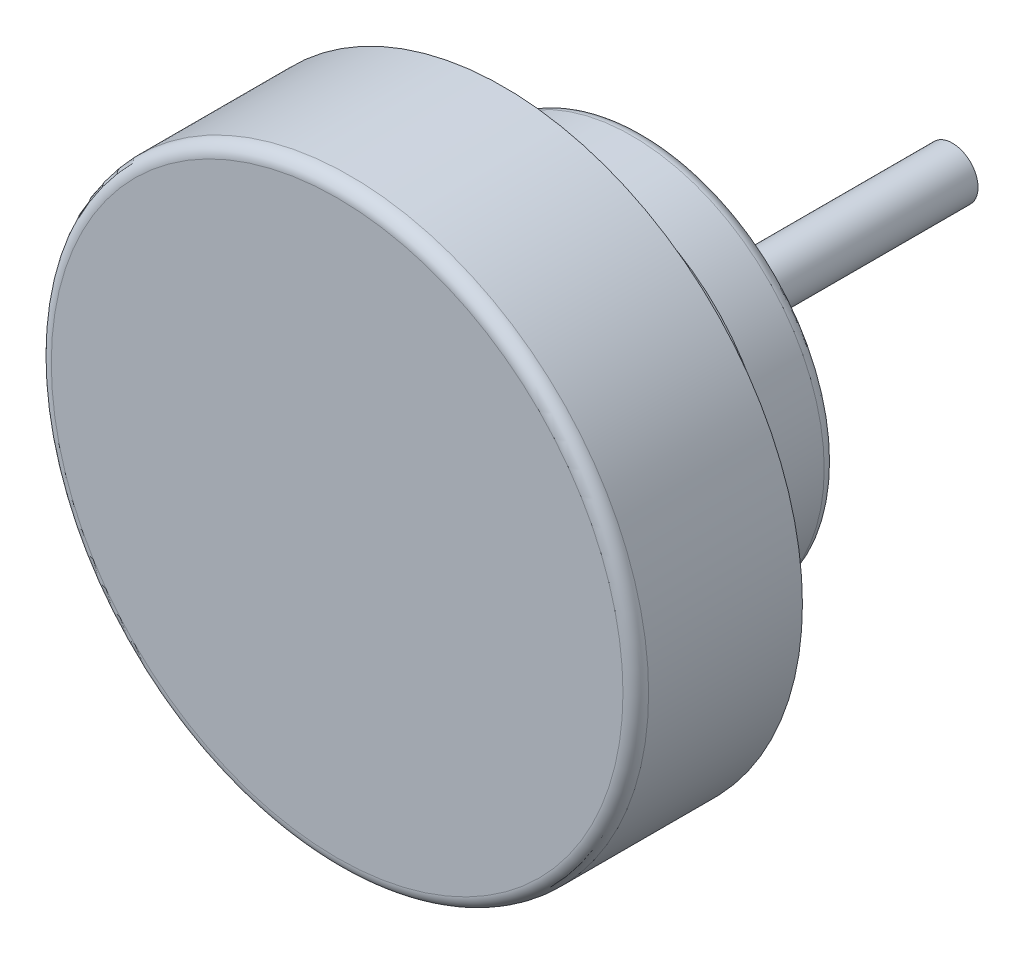
from build123d import *

# Parameters (mm, degrees)
SKETCH1_R           = 11.65
BOSS_EXTRUDE1_DEPTH = 6.5
FILLET1_R           = 0.5
SKETCH2_R           = 3.25
BOSS_EXTRUDE2_DEPTH = 3
SKETCH3_R           = 7.5
BOSS_EXTRUDE3_DEPTH = 2.5
FILLET2_R           = 0.5
SKETCH4_R           = 1
BOSS_EXTRUDE4_DEPTH = 12
CUT_EXTRUDE1_REACH  = 22.382
SKETCH5_R           = 1


with BuildPart() as part:
    # Sketch1 → Boss-Extrude1 (new body)
    with BuildSketch(Plane.XY):
        Circle(SKETCH1_R)
    extrude(amount=BOSS_EXTRUDE1_DEPTH)

    # Fillet1
    fillet1_edges = [part.edges().sort_by_distance(p)[0] for p in [
        (-11.65, 0, 6.5),
    ]]
    fillet(fillet1_edges, radius=FILLET1_R)

    # Sketch2 → Boss-Extrude2 (add)
    with BuildSketch(Plane(origin=(0, 0, 0), x_dir=(-1, 0, 0), z_dir=(0, 0, -1))):
        Circle(SKETCH2_R)
    extrude(amount=BOSS_EXTRUDE2_DEPTH)

    # Sketch3 → Boss-Extrude3 (add)
    with BuildSketch(Plane(origin=(0, 0, -3), x_dir=(-1, 0, 0), z_dir=(0, 0, -1))):
        Circle(SKETCH3_R)
    extrude(amount=BOSS_EXTRUDE3_DEPTH)

    # Fillet2
    fillet2_edges = [part.edges().sort_by_distance(p)[0] for p in [
        (7.5, 0, -5.5),
    ]]
    fillet(fillet2_edges, radius=FILLET2_R)

    # Sketch4 → Boss-Extrude4 (add)
    with BuildSketch(Plane(origin=(0, 0, -5.5), x_dir=(-1, 0, 0), z_dir=(0, 0, -1))):
        Circle(SKETCH4_R)
    extrude(amount=BOSS_EXTRUDE4_DEPTH)

    # Sketch5 → Cut-Extrude1 (cut, up to next)
    with BuildSketch(Plane(origin=(0, 0, -5.5), x_dir=(-1, 0, 0), z_dir=(0, 0, -1)), mode=Mode.PRIVATE) as cut_extrude1_sk1:
        with Locations((4.54663337, -2.625)):
            Circle(SKETCH5_R)
    cut_extrude1_tool1 = extrude(cut_extrude1_sk1.sketch, amount=-CUT_EXTRUDE1_REACH, mode=Mode.PRIVATE) & part.part
    # Sketch5 → Cut-Extrude1 (cut, up to next)
    with BuildSketch(Plane(origin=(0, 0, -5.5), x_dir=(-1, 0, 0), z_dir=(0, 0, -1)), mode=Mode.PRIVATE) as cut_extrude1_sk2:
        with Locations((0, 5.25)):
            Circle(SKETCH5_R)
    cut_extrude1_tool2 = extrude(cut_extrude1_sk2.sketch, amount=-CUT_EXTRUDE1_REACH, mode=Mode.PRIVATE) & part.part
    # Sketch5 → Cut-Extrude1 (cut, up to next)
    with BuildSketch(Plane(origin=(0, 0, -5.5), x_dir=(-1, 0, 0), z_dir=(0, 0, -1)), mode=Mode.PRIVATE) as cut_extrude1_sk3:
        with Locations((-4.54663337, -2.625)):
            Circle(SKETCH5_R)
    cut_extrude1_tool3 = extrude(cut_extrude1_sk3.sketch, amount=-CUT_EXTRUDE1_REACH, mode=Mode.PRIVATE) & part.part
    add(cut_extrude1_tool1.solids().sort_by_distance((-4.546633, -2.625, -5.5))[0], mode=Mode.SUBTRACT)
    add(cut_extrude1_tool2.solids().sort_by_distance((0, 5.25, -5.5))[0], mode=Mode.SUBTRACT)
    add(cut_extrude1_tool3.solids().sort_by_distance((4.546633, -2.625, -5.5))[0], mode=Mode.SUBTRACT)


solid = part.part
